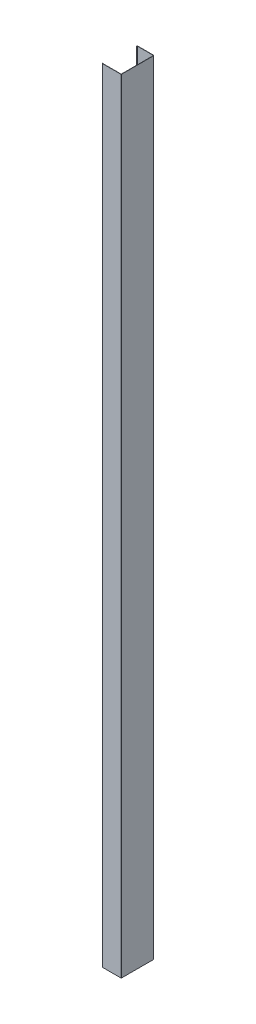
from build123d import *

# Parameters (mm, degrees)
SM_BASE_FLANGE_1_DEPTH = 2349.25


# Sheet-metal steps are written as plain solids
with BuildPart() as part:
    # Sketch 1 → Базовая кромка1 (new body)
    with BuildSketch(Plane(origin=(0, 0, 0), x_dir=(1, 0, 0), z_dir=(0, 1, 0))):
        with BuildLine():
            Line((-50, -3), (-50, -1.5))
            ThreePointArc((-50, -1.5), (-49.560660172, -0.439339828), (-48.5, 0))
            Line((-48.5, 0), (-1.5, 0))
            ThreePointArc((-1.5, 0), (-0.439339828, -0.439339828), (0, -1.5))
            Line((0, -1.5), (0, -97))
            ThreePointArc((0, -97), (-0.439339828, -98.060660172), (-1.5, -98.5))
            Line((-1.5, -98.5), (-56.31117163, -98.5))
            ThreePointArc((-56.31117163, -98.5), (-57.371831802, -98.060660172), (-57.81117163, -97))
            Line((-57.81117163, -97), (-57.81117163, -95.5))
            Line((-57.81117163, -95.5), (-57.06117163, -95.5))
            Line((-57.06117163, -95.5), (-57.06117163, -97))
            ThreePointArc((-57.06117163, -97), (-56.841501716, -97.530330086), (-56.31117163, -97.75))
            Line((-56.31117163, -97.75), (-1.5, -97.75))
            ThreePointArc((-1.5, -97.75), (-0.969669914, -97.530330086), (-0.75, -97))
            Line((-0.75, -97), (-0.75, -1.5))
            ThreePointArc((-0.75, -1.5), (-0.969669914, -0.969669914), (-1.5, -0.75))
            Line((-1.5, -0.75), (-48.5, -0.75))
            ThreePointArc((-48.5, -0.75), (-49.030330086, -0.969669914), (-49.25, -1.5))
            Line((-49.25, -1.5), (-49.25, -3))
            Line((-49.25, -3), (-50, -3))
        make_face()
    extrude(amount=SM_BASE_FLANGE_1_DEPTH)


solid = part.part
